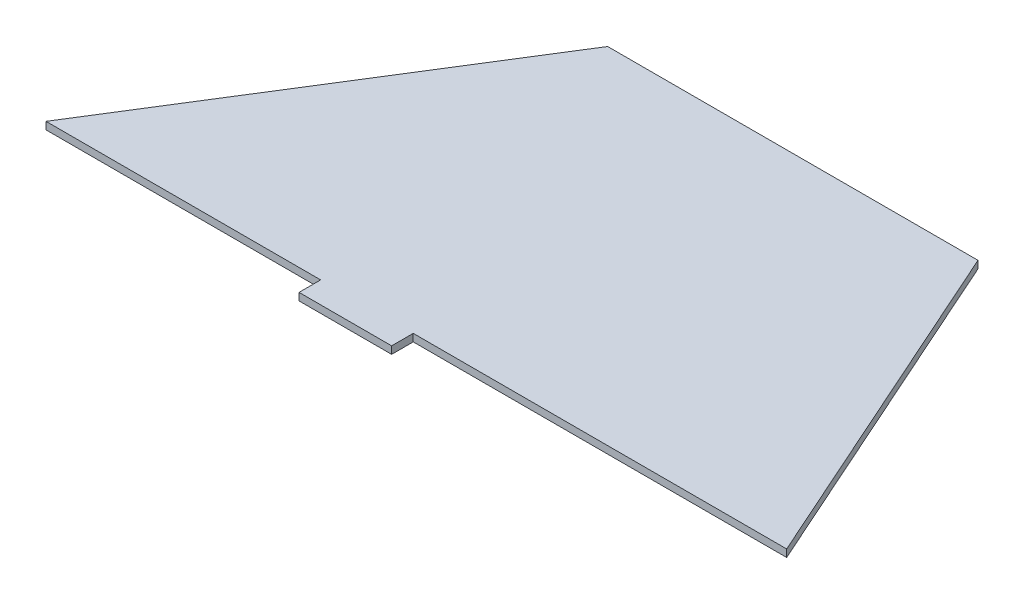
from build123d import *

# Parameters (mm, degrees)
BOSS_EXTRUDE1_DEPTH = 3.048


with BuildPart() as part:
    # Sketch1 → Boss-Extrude1 (new body)
    with BuildSketch(Plane(origin=(0, 0, 0), x_dir=(1, 0, 0), z_dir=(0, 1, 0))):
        Polygon((0, 0), (88.9, 142.24), (241.3, 142.24), (304.8, 0), (151.13, 0), (151.13, -8.89), (113.03, -8.89), (113.03, 0), align=None)
    extrude(amount=BOSS_EXTRUDE1_DEPTH)


solid = part.part
